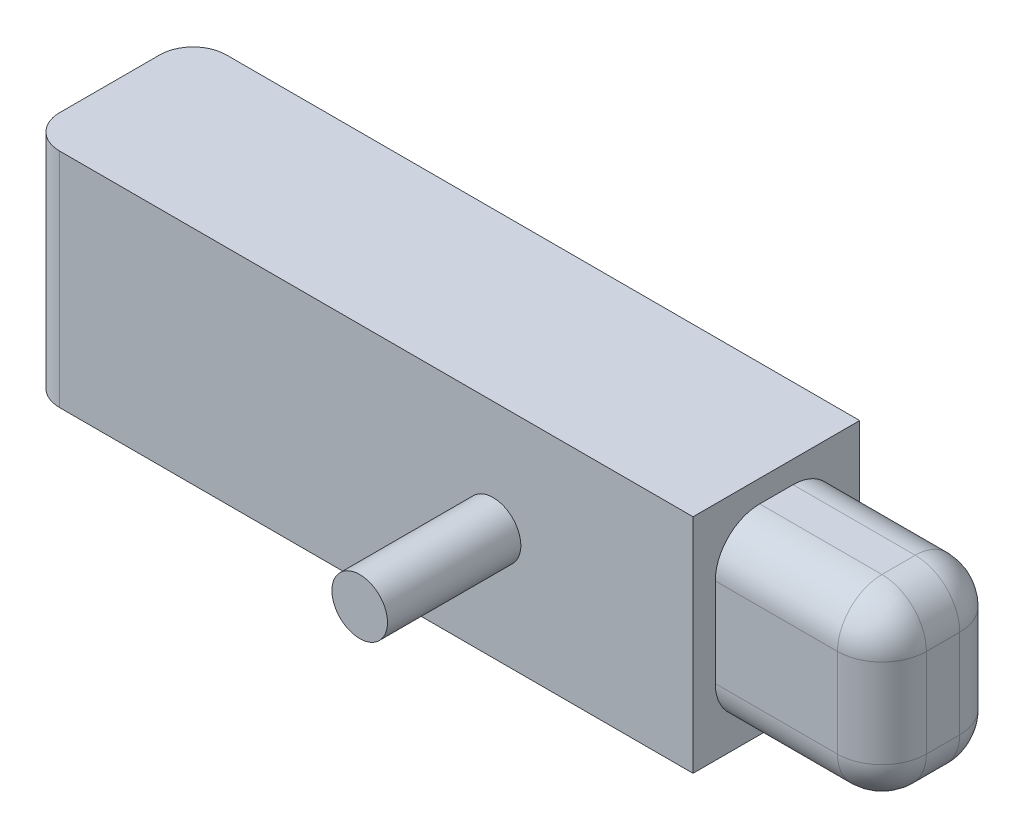
from build123d import *

# Parameters (mm, degrees)
CROQUIS1_W              = 60
CROQUIS1_H              = 15
SALIENTE_EXTRUIR1_DEPTH = 20
CROQUIS2_R              = 2.5
SALIENTE_EXTRUIR2_DEPTH = 12
CROQUIS3_W              = 11
CROQUIS3_H              = 16
SALIENTE_EXTRUIR3_DEPTH = 15
REDONDEO1_R             = 4
REDONDEO2_R             = 4
REDONDEO3_R             = 3
ESCALA1_SCALE           = 2


with BuildPart() as part:
    # Croquis1 → Saliente-Extruir1 (new body)
    with BuildSketch(Plane(origin=(0, 0, 0), x_dir=(1, 0, 0), z_dir=(0, 1, 0))):
        Rectangle(CROQUIS1_W, CROQUIS1_H)
    extrude(amount=SALIENTE_EXTRUIR1_DEPTH)

    # Croquis2 → Saliente-Extruir2 (add)
    with BuildSketch(Plane.XY.offset(7.5)):
        with Locations((12, 10)):
            Circle(CROQUIS2_R)
    extrude(amount=SALIENTE_EXTRUIR2_DEPTH)

    # Croquis3 → Saliente-Extruir3 (add)
    with BuildSketch(Plane(origin=(30, 0, 0), x_dir=(0, 0, -1), z_dir=(1, 0, 0))):
        with Locations((0, 10)):
            Rectangle(CROQUIS3_W, CROQUIS3_H)
    extrude(amount=SALIENTE_EXTRUIR3_DEPTH)

    # Redondeo1
    redondeo1_edges = [part.edges().sort_by_distance(p)[0] for p in [
        (37.5, 18, -5.5),
        (37.5, 2, -5.5),
        (37.5, 2, 5.5),
        (37.5, 18, 5.5),
    ]]
    fillet(redondeo1_edges, radius=REDONDEO1_R)

    # Redondeo2
    redondeo2_edges = [part.edges().sort_by_distance(p)[0] for p in [
        (45, 3.171572875, -4.328427125),
        (45, 2, 0),
        (45, 3.171572875, 4.328427125),
        (45, 10, 5.5),
        (45, 16.828427125, 4.328427125),
        (45, 18, 0),
        (45, 16.828427125, -4.328427125),
        (45, 10, -5.5),
    ]]
    fillet(redondeo2_edges, radius=REDONDEO2_R)

    # Redondeo3
    redondeo3_edges = [part.edges().sort_by_distance(p)[0] for p in [
        (-30, 10, -7.5),
        (-30, 10, 7.5),
    ]]
    fillet(redondeo3_edges, radius=REDONDEO3_R)


with BuildPart() as part_1:
    # Escala1: scaled about (4.405278124, 10, 0.15554504)
    add(part.part.scale(ESCALA1_SCALE).moved(Location((-4.405278124, -10, -0.15554504))))


solid = part_1.part
